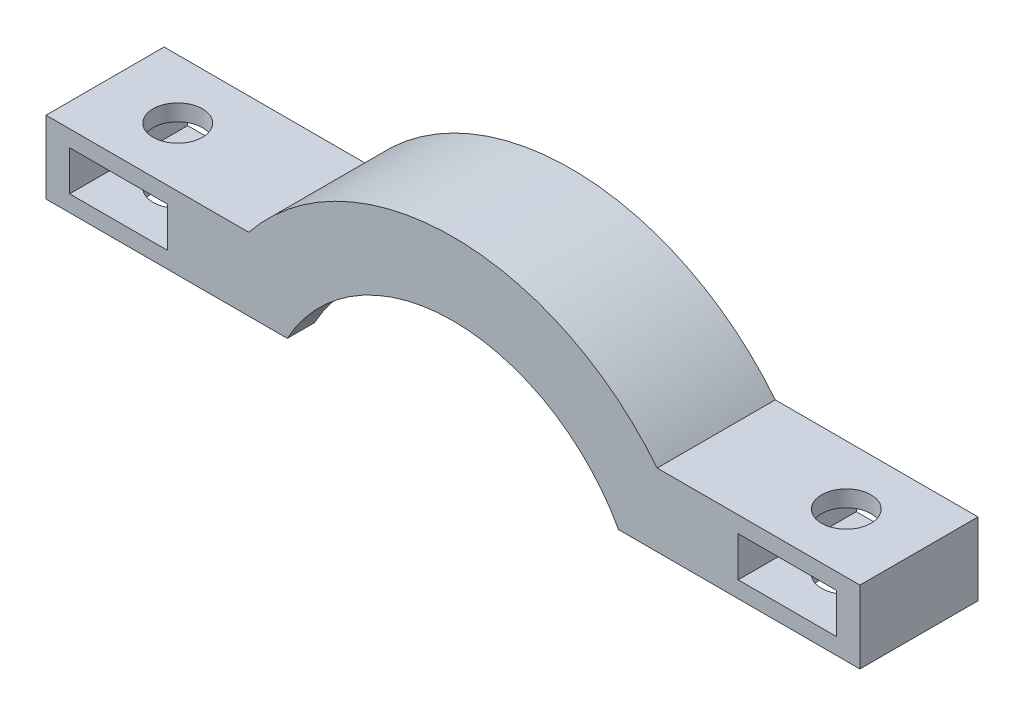
from build123d import *

# Parameters (mm, degrees)
SKETCH1_R                   = 18.288
BOSS_EXTRUDE1_DEPTH         = 19.05
SKETCH3_R                   = 13.208
CUT_EXTRUDE1_DEPTH          = 33.121712096
SKETCH15_W                  = 19.05
SKETCH15_H                  = 17.526
BOSS_EXTRUDE3_DEPTH         = 15.24
SKETCH16_W                  = 11.43
SKETCH16_H                  = 5.842
CUT_EXTRUDE4_DEPTH          = 39.82462909
CHAMFER1_SIZE               = 8.129699408
CHAMFER1_SIZE_2             = 5.08
F_1_4_CLEARANCE_HOLE1_D     = 6.7564
F_1_4_CLEARANCE_HOLE1_DEPTH = 3.448428068
SKETCH19_R                  = 18.288
SKETCH19_R_2                = 13.208
CUT_EXTRUDE5_DEPTH          = 0.762
CUT_EXTRUDE6_START          = -2.54
SKETCH20_R                  = 18.288
CUT_EXTRUDE6_DEPTH          = 2.54
SKETCH21_R                  = 18.288
CUT_EXTRUDE7_DEPTH          = 7.493
SKETCH22_W                  = 19.05
SKETCH22_H                  = 4.191
CUT_EXTRUDE8_DEPTH          = 42.148
SKETCH24_R                  = 14.478
CUT_EXTRUDE10_DEPTH         = 5.334
SKETCH25_W                  = 8.255
SKETCH25_H                  = 5.08
BOSS_EXTRUDE4_DEPTH         = 15.24
F_4_CLEARANCE_HOLE1_D       = 3.4544
SKETCH28_W                  = 6.858
SKETCH28_H                  = 2.794
CUT_EXTRUDE11_DEPTH         = 43.003222079
MIRROR3_COPY_1_SKETCH_W     = 6.858
MIRROR3_COPY_1_SKETCH_H     = 2.794
MIRROR3_COPY_1_DEPTH        = 43.003222079
SKETCH29_W                  = 78.170578527
SKETCH29_H                  = 29.425688311
CUT_EXTRUDE12_DEPTH         = 35.306
CHAMFER2_SIZE               = 1.27


# Some blends are built 0.0001 mm under size
with BuildPart() as part:
    # Sketch1 → Boss-Extrude1 (new body)
    with BuildSketch(Plane.XY):
        with Locations(Location((0, 0, 0), (0, 0, 180))):
            Circle(SKETCH1_R)
    extrude(amount=BOSS_EXTRUDE1_DEPTH)

    # Sketch3 → Cut-Extrude1 (cut, through all)
    with BuildSketch(Plane.XY.offset(19.05)):
        Circle(SKETCH3_R)
    extrude(amount=-CUT_EXTRUDE1_DEPTH, mode=Mode.SUBTRACT)

    # Sketch15 → Boss-Extrude3 (add)
    with BuildSketch(Plane(origin=(0, -13.716, 0), x_dir=(1, 0, 0), z_dir=(0, 1, 0))):
        with Locations((0, -9.525)):
            Rectangle(SKETCH15_W, SKETCH15_H)
    extrude(amount=-BOSS_EXTRUDE3_DEPTH)

    # Sketch16 → Cut-Extrude4 (cut, through all)
    with BuildSketch(Plane.XY.offset(18.288)):
        with Locations((0, -22.586571932)):
            Rectangle(SKETCH16_W, SKETCH16_H)
    extrude(amount=-CUT_EXTRUDE4_DEPTH, mode=Mode.SUBTRACT)

    # Chamfer1
    # the kernel refuses this chamfer: 8.129699408, 5.08 mm, written as the material it takes off along each edge
    with BuildSketch(Plane(origin=(-30.543101737, -28.956, 0.762), x_dir=(0, 0.9997899140358644, -0.020497019104217945), z_dir=(1, 0, 0))) as chamfer1_piece_1:
        Polygon((CHAMFER1_SIZE * 0.999789913978, CHAMFER1_SIZE * 0.020497019103), (-CHAMFER1_SIZE_2 * 0.0204970191042, CHAMFER1_SIZE_2 * 0.999789914036), (0, 0), align=None)
    extrude(amount=61.086203475, mode=Mode.SUBTRACT)

    # 1/4 Clearance Hole1
    with Locations(Plane(origin=(0, -28.956, 0), x_dir=(-1, 0, 0), z_dir=(0, -1, 0))):
        with Locations((0, -12.021417661)):
            Hole(F_1_4_CLEARANCE_HOLE1_D / 2, depth=F_1_4_CLEARANCE_HOLE1_DEPTH)

    # Sketch19 → Cut-Extrude5 (cut)
    with BuildSketch(Plane.XY.offset(19.05)):
        with Locations(Location((0, 0, 0), (0, 0, 238.611833536))):
            Circle(SKETCH19_R)
        Circle(SKETCH19_R_2, mode=Mode.SUBTRACT)
    extrude(amount=-CUT_EXTRUDE5_DEPTH, mode=Mode.SUBTRACT)

    # Sketch20 → Cut-Extrude6 (cut)
    with BuildSketch(Plane.XY.offset(18.288).offset(CUT_EXTRUDE6_START)):
        with Locations(Location((0, 0, 0), (0, 0, 238.611833536))):
            Circle(SKETCH20_R)
    extrude(amount=CUT_EXTRUDE6_DEPTH, mode=Mode.SUBTRACT)

    # Sketch21 → Cut-Extrude7 (cut)
    with BuildSketch(Plane(origin=(0, 0, 0), x_dir=(-1, 0, 0), z_dir=(0, 0, -1))):
        Circle(SKETCH21_R)
    extrude(amount=-CUT_EXTRUDE7_DEPTH, mode=Mode.SUBTRACT)

    # Sketch22 → Cut-Extrude8 (cut, through all)
    with BuildSketch(Plane(origin=(0, -13.716, 0), x_dir=(1, 0, 0), z_dir=(0, 1, 0))):
        with Locations((0, -2.8575)):
            Rectangle(SKETCH22_W, SKETCH22_H)
    extrude(amount=-CUT_EXTRUDE8_DEPTH, mode=Mode.SUBTRACT)

    # Sketch24 → Cut-Extrude10 (cut)
    with BuildSketch(Plane.XY.offset(13.843)):
        Circle(SKETCH24_R)
    extrude(amount=-CUT_EXTRUDE10_DEPTH, mode=Mode.SUBTRACT)

    # Sketch25 → Boss-Extrude4 (add)
    with BuildSketch(Plane(origin=(13.208, 0, 0), x_dir=(0, 0, -1), z_dir=(1, 0, 0))):
        with Locations((-11.6205, 8.89)):
            Rectangle(SKETCH25_W, SKETCH25_H)
        with Locations((-11.6205, -8.89)):
            Rectangle(SKETCH25_W, SKETCH25_H)
    boss_extrude4 = extrude(amount=BOSS_EXTRUDE4_DEPTH)

    # #4 Clearance Hole1 (through all)
    with Locations(Plane(origin=(0, -11.43, 0), x_dir=(-1, 0, 0), z_dir=(0, -1, 0))):
        with Locations((-23.368, -11.6205)):
            f_4_clearance_hole1 = Hole(F_4_CLEARANCE_HOLE1_D / 2)

    # Sketch28 → Cut-Extrude11 (cut, through all)
    with BuildSketch(Plane.XY.offset(15.748)):
        with Locations((23.368, -8.89)):
            Rectangle(SKETCH28_W, SKETCH28_H)
    cut_extrude11 = extrude(amount=-CUT_EXTRUDE11_DEPTH, mode=Mode.SUBTRACT)

    # Mirror2: Cut-Extrude11 across plane
    add(cut_extrude11.mirror(Plane.ZX), mode=Mode.SUBTRACT)

    # Mirror3: Boss-Extrude4, #4 Clearance Hole1, Cut-Extrude11 across plane
    add(boss_extrude4.mirror(Plane(origin=(0, 0, 0), x_dir=(0, 0, 1), z_dir=(1, 0, 0))))
    add(f_4_clearance_hole1.mirror(Plane(origin=(0, 0, 0), x_dir=(0, 0, 1), z_dir=(1, 0, 0))), mode=Mode.SUBTRACT)
    add(cut_extrude11.mirror(Plane(origin=(0, 0, 0), x_dir=(0, 0, 1), z_dir=(1, 0, 0))), mode=Mode.SUBTRACT)

    # Mirror3 copy 1 sketch → Mirror3 copy 1 (cut, through all)
    with BuildSketch(Plane(origin=(0, 0, 15.748), x_dir=(-1, 0, 0), z_dir=(0, 0, 1))):
        with Locations((23.368, -8.89)):
            Rectangle(MIRROR3_COPY_1_SKETCH_W, MIRROR3_COPY_1_SKETCH_H)
    extrude(amount=-MIRROR3_COPY_1_DEPTH, mode=Mode.SUBTRACT)

    # Sketch29 → Cut-Extrude12 (cut)
    with BuildSketch(Plane.XZ.offset(28.956)):
        with Locations((-0.790643495, 9.076690496)):
            Rectangle(SKETCH29_W, SKETCH29_H)
    extrude(amount=-CUT_EXTRUDE12_DEPTH, mode=Mode.SUBTRACT)

    # Chamfer2
    chamfer2_edges = [part.edges().sort_by_distance(p)[0] for p in [
        (0, 14.478, 8.509),
        (0, 14.478, 13.843),
    ]]
    chamfer(chamfer2_edges, length=CHAMFER2_SIZE - 0.0001)  # a hair under: the kernel refuses the full size


solid = part.part
